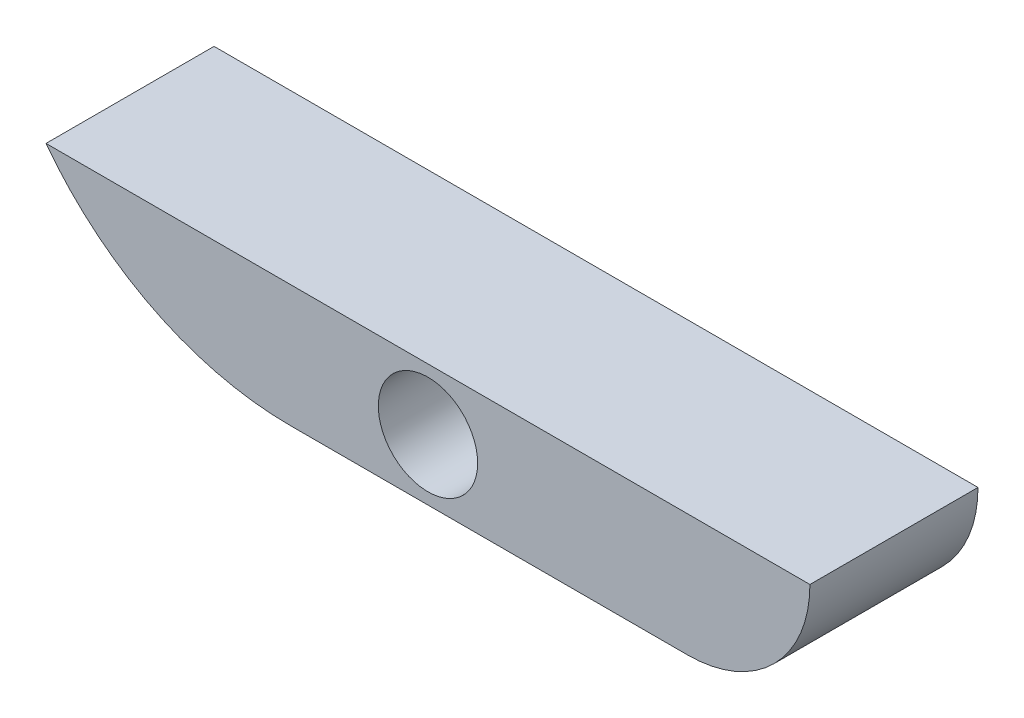
from build123d import *

# Parameters (mm, degrees)
SKETCH1_W           = 50
SKETCH1_H           = 11
BOSS_EXTRUDE1_DEPTH = 8
FILLET1_R           = 20
FILLET2_R           = 8
SKETCH2_R           = 3.25
CUT_EXTRUDE1_DEPTH  = 21


# Some blends are built 0.0001 mm under size
with BuildPart() as part:
    # Sketch1 → Boss-Extrude1 (new body)
    with BuildSketch(Plane(origin=(0, 0, 0), x_dir=(1, 0, 0), z_dir=(0, 1, 0))):
        Rectangle(SKETCH1_W, SKETCH1_H)
    extrude(amount=BOSS_EXTRUDE1_DEPTH)

    # Fillet1
    # the kernel refuses this fillet: 20 mm, written as the material it takes off along each edge
    with BuildSketch(Plane(origin=(-25, 0, -45.5), x_dir=(0, 1, 0), z_dir=(0, 0, 1))) as fillet1_piece_1:
        with BuildLine():
            CenterArc((20, -16), FILLET1_R, 126.869897646, 53.130102354)
            Line((0, -16), (-0.4, -16))
            Line((-0.4, -16), (-0.4, 0))
            Line((-0.4, 0), (0, 0.4))
            ThreePointArc((0, 0.4), (4, 0.4), (7.76, 0.32))
            Line((7.76, 0.32), (8, 0))
        make_face()
    extrude(amount=91, mode=Mode.SUBTRACT)

    # Fillet2
    fillet2_edges = [part.edges().sort_by_distance(p)[0] for p in [
        (25, 0, 0),
    ]]
    fillet(fillet2_edges, radius=FILLET2_R - 0.0001)  # a hair under: the kernel refuses the full size

    # Sketch2 → Cut-Extrude1 (cut)
    with BuildSketch(Plane.XY.offset(5.5)):
        with Locations((0, 4)):
            Circle(SKETCH2_R)
    extrude(amount=-CUT_EXTRUDE1_DEPTH, mode=Mode.SUBTRACT)


solid = part.part
